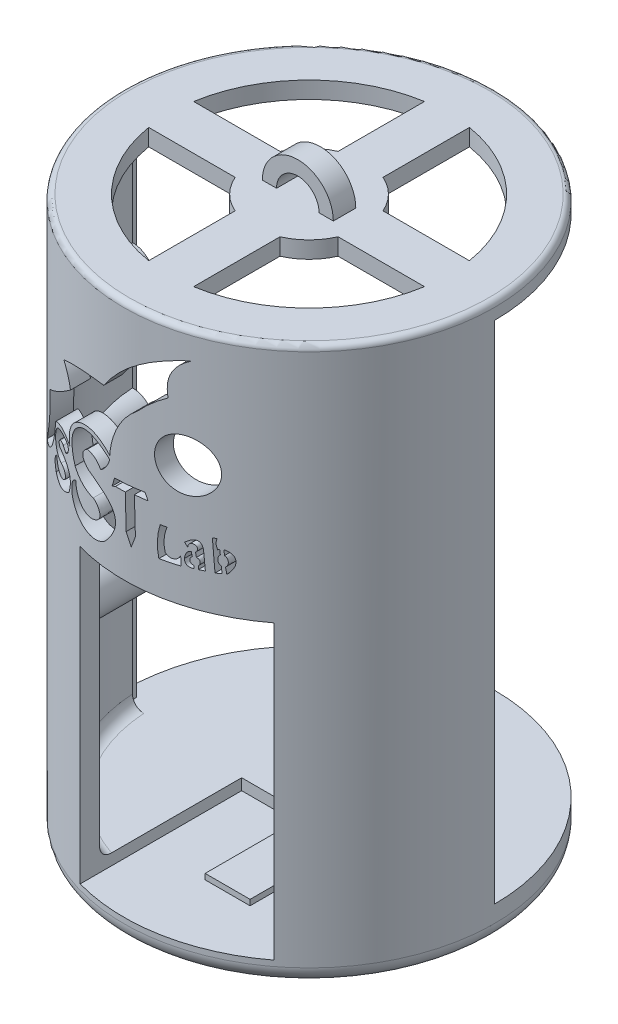
from build123d import *

# Parameters (mm, degrees)
SKETCH1_R                = 33
BOSS_EXTRUDE1_DEPTH      = 3
BOSS_EXTRUDE2_START      = 90
BOSS_EXTRUDE2_DEPTH      = 90
FILLET1_R                = 1
FILLET2_R                = 1
CUT_EXTRUDE2_DEPTH       = 10
BOSS_EXTRUDE3_DEPTH      = 2
BOSS_EXTRUDE5_START      = 6
SKETCH9_R                = 33
BOSS_EXTRUDE5_DEPTH      = 6
FILLET5_R                = 2
BOSS_EXTRUDE6_REACH      = 109.313
BOSS_EXTRUDE6_END_RADIUS = 29.691838434
SKETCH23_R               = 1
BOSS_EXTRUDE7_REACH      = 109.313
BOSS_EXTRUDE7_END_RADIUS = 29.691838434
SKETCH27_R               = 1
CUT_EXTRUDE3_DEPTH       = 3
BOSS_EXTRUDE8_REACH      = 109.313
BOSS_EXTRUDE8_END_RADIUS = 29.691838434
SKETCH28_R               = 1
SKETCH29_R               = 4.559697027
CUT_EXTRUDE4_DEPTH       = 122.082616505
SKETCH38_W               = 29
SKETCH38_H               = 52
CUT_EXTRUDE5_DEPTH       = 30
SKETCH44_W               = 8
SKETCH44_H               = 17
BOSS_EXTRUDE10_DEPTH     = 1
FILLET3_R                = 3


with BuildPart() as part:
    # Sketch1 → Boss-Extrude1 (new body)
    with BuildSketch(Plane(origin=(0, 0, 0), x_dir=(1, 0, 0), z_dir=(0, 1, 0))):
        Circle(SKETCH1_R)
    extrude(amount=BOSS_EXTRUDE1_DEPTH)

    # Sketch2 → Boss-Extrude2 (add)
    with BuildSketch(Plane.XZ.offset(BOSS_EXTRUDE2_START)):
        with BuildLine():
            Line((-33, 0), (-30.737227765, 0))
            Line((-30.737227765, 0), (-30.737227765, 1.8))
            Line((-30.737227765, 1.8), (-29.637227765, 1.8))
            ThreePointArc((-29.637227765, 1.8), (0, 29.691838434), (29.637227765, 1.8))
            Line((29.637227765, 1.8), (30.737227765, 1.8))
            Line((30.737227765, 1.8), (30.737227765, 0))
            Line((30.737227765, 0), (33, 0))
            ThreePointArc((33, 0), (0, 33), (-33, 0))
        make_face()
    extrude(amount=-BOSS_EXTRUDE2_DEPTH)

    # Fillet1
    fillet1_edges = [part.edges().sort_by_distance(p)[0] for p in [
        (0, 0, 29.691838434),
    ]]
    fillet(fillet1_edges, radius=FILLET1_R)

    # Fillet2
    fillet2_edges = [part.edges().sort_by_distance(p)[0] for p in [
        (-33, 3, 0),
    ]]
    fillet(fillet2_edges, radius=FILLET2_R)

    # Sketch5 → Cut-Extrude2 (cut)
    with BuildSketch(Plane(origin=(0, 3, 0), x_dir=(1, 0, 0), z_dir=(0, 1, 0))):
        with BuildLine():
            ThreePointArc((4, 9.16515139), (7.071067812, 7.071067812), (9.16515139, 4))
            Line((9.16515139, 4), (24.550793491, 4))
            ThreePointArc((24.550793491, 4), (17.588937732, 17.588937732), (4, 24.550793491))
            Line((4, 24.550793491), (4, 9.16515139))
        make_face()
        with BuildLine():
            Line((24.550793491, -4), (9.16515139, -4))
            ThreePointArc((9.16515139, -4), (7.071067812, -7.071067812), (4, -9.16515139))
            Line((4, -9.16515139), (4, -24.550793491))
            ThreePointArc((4, -24.550793491), (17.588937732, -17.588937732), (24.550793491, -4))
        make_face()
        with BuildLine():
            ThreePointArc((-9.16515139, 4), (-7.071067812, 7.071067812), (-4, 9.16515139))
            Line((-4, 9.16515139), (-4, 24.550793491))
            ThreePointArc((-4, 24.550793491), (-17.588937732, 17.588937732), (-24.550793491, 4))
            Line((-24.550793491, 4), (-9.16515139, 4))
        make_face()
        with BuildLine():
            Line((-4, -24.550793491), (-4, -9.16515139))
            ThreePointArc((-4, -9.16515139), (-7.071067812, -7.071067812), (-9.16515139, -4))
            Line((-9.16515139, -4), (-24.550793491, -4))
            ThreePointArc((-24.550793491, -4), (-17.588937732, -17.588937732), (-4, -24.550793491))
        make_face()
    extrude(amount=-CUT_EXTRUDE2_DEPTH, mode=Mode.SUBTRACT)

    # Sketch8 → Boss-Extrude3 (add, symmetric)
    with BuildSketch(Plane.XY):
        with BuildLine():
            Line((3.786752201, 3), (6.320875359, 3))
            ThreePointArc((6.320875359, 3), (0, 9.320875359), (-6.320875359, 3))
            Line((-6.320875359, 3), (-3.786752201, 3))
            ThreePointArc((-3.786752201, 3), (0, 6.786752201), (3.786752201, 3))
        make_face()
    extrude(amount=BOSS_EXTRUDE3_DEPTH, both=True)

    # Sketch9 → Boss-Extrude5 (add)
    with BuildSketch(Plane.XZ.offset(90).offset(BOSS_EXTRUDE5_START)):
        Circle(SKETCH9_R)
    extrude(amount=-BOSS_EXTRUDE5_DEPTH)

    # Fillet5
    fillet5_edges = [part.edges().sort_by_distance(p)[0] for p in [
        (0, -90, 29.691838434),
    ]]
    fillet(fillet5_edges, radius=FILLET5_R)

    # Boss-Extrude6: up to this cylinder (the profile starts inside it)
    boss_extrude6_end = Plane(origin=(0, -33.6, 0), z_dir=(0, 1, 0)) * Cylinder(BOSS_EXTRUDE6_END_RADIUS, 301.409676867, mode=Mode.PRIVATE)
    # Sketch23 → Boss-Extrude6 (add, up to the surface)
    with BuildSketch(Plane.XY.offset(1.8), mode=Mode.PRIVATE) as boss_extrude6_sk1:
        with BuildLine():
            Line((29.637227765, -26.4), (29.637227765, -18.4))
            ThreePointArc((29.637227765, -18.4), (25.637227765, -22.4), (29.637227765, -26.4))
        make_face()
        with Locations((28.137227765, -22.4)):
            Circle(SKETCH23_R, mode=Mode.SUBTRACT)
    boss_extrude6_tool1 = extrude(boss_extrude6_sk1.sketch, amount=BOSS_EXTRUDE6_REACH, mode=Mode.PRIVATE) & boss_extrude6_end
    add(boss_extrude6_tool1.solids().sort_by_distance((29.547785, -22.4, 1.8))[0])
    # Sketch23 → Boss-Extrude6 (add, up to the surface)
    with BuildSketch(Plane.XY.offset(1.8), mode=Mode.PRIVATE) as boss_extrude6_sk2:
        with BuildLine():
            Line((29.637227765, -48.8), (29.637227765, -40.8))
            ThreePointArc((29.637227765, -40.8), (25.637227765, -44.8), (29.637227765, -48.8))
        make_face()
        with Locations((28.137227765, -44.8)):
            Circle(SKETCH23_R, mode=Mode.SUBTRACT)
    boss_extrude6_tool2 = extrude(boss_extrude6_sk2.sketch, amount=BOSS_EXTRUDE6_REACH, mode=Mode.PRIVATE) & boss_extrude6_end
    add(boss_extrude6_tool2.solids().sort_by_distance((29.547785, -44.8, 1.8))[0])

    # Boss-Extrude7: up to this cylinder (the profile starts inside it)
    boss_extrude7_end = Plane(origin=(0, -67.2, 0), z_dir=(0, 1, 0)) * Cylinder(BOSS_EXTRUDE7_END_RADIUS, 279.009676867, mode=Mode.PRIVATE)
    # Sketch25 → Boss-Extrude7 (add, up to the surface)
    with BuildSketch(Plane.XY.offset(1.8), mode=Mode.PRIVATE) as boss_extrude7_sk1:
        with BuildLine():
            Line((29.637227765, -62.8), (29.637227765, -71.6))
            ThreePointArc((29.637227765, -71.6), (25.237227765, -67.2), (29.637227765, -62.8))
        make_face()
    boss_extrude7_tool1 = extrude(boss_extrude7_sk1.sketch, amount=BOSS_EXTRUDE7_REACH, mode=Mode.PRIVATE) & boss_extrude7_end
    boss_extrude7 = boss_extrude7_tool1.solids().sort_by_distance((27.76981, -67.2, 1.8))[0]
    add(boss_extrude7)

    # Sketch27 → Cut-Extrude3 (cut)
    with BuildSketch(Plane(origin=(0, 0, 1.8), x_dir=(-1, 0, 0), z_dir=(0, 0, -1))):
        with Locations((-28.137227765, -67.2)):
            Circle(SKETCH27_R)
    cut_extrude3 = extrude(amount=-CUT_EXTRUDE3_DEPTH, mode=Mode.SUBTRACT)

    # Mirror8: Boss-Extrude7, Cut-Extrude3 across plane
    add(boss_extrude7.mirror(Plane(origin=(0, 0, 0), x_dir=(0, 0, 1), z_dir=(1, 0, 0))))
    add(cut_extrude3.mirror(Plane(origin=(0, 0, 0), x_dir=(0, 0, 1), z_dir=(1, 0, 0))), mode=Mode.SUBTRACT)

    # Boss-Extrude8: up to this cylinder (the profile starts inside it)
    boss_extrude8_end = Plane(origin=(0, -33.6, 0), z_dir=(0, 1, 0)) * Cylinder(BOSS_EXTRUDE8_END_RADIUS, 301.409676867, mode=Mode.PRIVATE)
    # Sketch28 → Boss-Extrude8 (add, up to the surface)
    with BuildSketch(Plane.XY.offset(1.8), mode=Mode.PRIVATE) as boss_extrude8_sk1:
        with BuildLine():
            Line((-29.637227765, -18.4), (-29.637227765, -26.4))
            ThreePointArc((-29.637227765, -26.4), (-25.637227765, -22.4), (-29.637227765, -18.4))
        make_face()
        with Locations((-28.137227765, -22.4)):
            Circle(SKETCH28_R, mode=Mode.SUBTRACT)
    boss_extrude8_tool1 = extrude(boss_extrude8_sk1.sketch, amount=BOSS_EXTRUDE8_REACH, mode=Mode.PRIVATE) & boss_extrude8_end
    add(boss_extrude8_tool1.solids().sort_by_distance((-29.547785, -22.4, 1.8))[0])
    # Sketch28 → Boss-Extrude8 (add, up to the surface)
    with BuildSketch(Plane.XY.offset(1.8), mode=Mode.PRIVATE) as boss_extrude8_sk2:
        with BuildLine():
            Line((-29.637227765, -40.8), (-29.637227765, -48.8))
            ThreePointArc((-29.637227765, -48.8), (-25.637227765, -44.8), (-29.637227765, -40.8))
        make_face()
        with Locations((-28.137227765, -44.8)):
            Circle(SKETCH28_R, mode=Mode.SUBTRACT)
    boss_extrude8_tool2 = extrude(boss_extrude8_sk2.sketch, amount=BOSS_EXTRUDE8_REACH, mode=Mode.PRIVATE) & boss_extrude8_end
    add(boss_extrude8_tool2.solids().sort_by_distance((-29.547785, -44.8, 1.8))[0])

    # Sketch29 → Cut-Extrude4 (cut, through all)
    with BuildSketch(Plane.XY.offset(33)):
        with Locations((9.656530357, -18.228015537)):
            Circle(SKETCH29_R)
        with BuildLine():
            Line((10.349709969, -31.260245046), (10.504361263, -32.023388105))
            ThreePointArc((10.504361263, -32.023388105), (10.171122291, -32.739064733), (10.726291598, -33.300338542))
            Line((10.726291598, -33.300338542), (10.726291598, -33.795731563))
            add(Edge.make_bspline(
                [(9.431302826, -32.657530694), (9.451626251, -33.478075731), (9.883289175, -33.857476021), (10.726291598, -33.795731563)],
                knots=[0, 0, 0, 0, 1, 1, 1, 1], degree=3))
            add(Edge.make_bspline(
                [(10.349709969, -31.260245046), (9.809186887, -31.369782299), (9.503051172, -31.835544181), (9.431302826, -32.657530694)],
                knots=[0.205595998, 0.205595998, 0.205595998, 0.205595998, 1, 1, 1, 1], degree=3))
        make_face()
        with BuildLine():
            Line((14.932280644, -33.437499716), (14.834440134, -33.451584224))
            Line((14.834440134, -33.451584224), (14.680633295, -32.383137957))
            add(Edge.make_bspline(
                [(14.680633295, -32.383137957), (16.063570974, -31.487524824), (14.555266559, -30.660195086)],
                knots=[0.323761722, 0.323761722, 0.323761722, 2.695207356, 2.695207356, 2.695207356], degree=2, weights=[1, 0.375627264, 1]))
            Line((14.555266559, -30.660195086), (14.499086471, -29.789527862))
            add(Edge.make_bspline(
                [(14.499086471, -29.789527862), (14.659655884, -29.797531434), (14.818635772, -29.837424421), (14.976026134, -29.909206822)],
                knots=[0.606506576, 0.606506576, 0.606506576, 0.606506576, 1, 1, 1, 1], degree=3))
            add(Edge.make_bspline(
                [(14.976026134, -29.909206822), (15.750605713, -30.28881355), (16.152277789, -31.654433994), (15.521176413, -32.722111185), (14.932280644, -33.437499716)],
                knots=[0, 0, 0, 0, 0.41403424, 1, 1, 1, 1], degree=3))
        make_face()
        with BuildLine():
            Line((13.079083104, -28.318630783), (13.661006417, -28.282376473))
            add(Edge.make_bspline(
                [(13.661006417, -28.282376473), (13.392897645, -29.113489523), (13.745282173, -29.979800603)],
                knots=[0, 0, 0, 1, 1, 1], degree=2))
            add(Edge.make_bspline(
                [(13.745282173, -29.979800603), (13.863069413, -29.915520876), (13.979782744, -29.872786142)],
                knots=[0, 0, 0, 0.186735441, 0.186735441, 0.186735441], degree=2))
            Line((13.979782744, -29.872786142), (14.061785189, -30.683993333))
            add(Edge.make_bspline(
                [(14.061785189, -30.683993333), (12.822472302, -31.565482282), (14.186132292, -32.383137957)],
                knots=[3.498707863, 3.498707863, 3.498707863, 5.804676601, 5.804676601, 5.804676601], degree=2, weights=[1, 0.405761602, 1]))
            Line((14.186132292, -32.383137957), (14.260406146, -33.534218565))
            Line((14.260406146, -33.534218565), (13.411630782, -33.656402955))
            Line((13.411630782, -33.656402955), (13.079083104, -28.318630783))
        make_face()
        with BuildLine():
            Line((9.914405122, -30.801450228), (9.459847308, -30.141421766))
            add(Edge.make_bspline(
                [(11.960627046, -30.421369973), (11.522478353, -28.335382418), (9.459847308, -30.141421766)],
                knots=[0, 0, 0, 1, 1, 1], degree=2))
            Line((11.960627046, -30.421369973), (12.199871952, -33.687801363))
            Line((12.199871952, -33.687801363), (11.29947712, -33.753749443))
            Line((11.29947712, -33.753749443), (11.29947712, -33.147540955))
            ThreePointArc((11.29947712, -33.147540955), (11.528241272, -32.477489187), (11.047448674, -31.957738394))
            Line((11.047448674, -31.957738394), (10.920132511, -31.187545545))
            ThreePointArc((10.920132511, -31.187545545), (10.780185216, -30.04914852), (9.914405122, -30.801450228))
        make_face()
        with BuildLine():
            Line((8.96002864, -34.001870268), (8.915516776, -32.284023801))
            ThreePointArc((8.915516776, -32.284023801), (7.95962245, -33.261727802), (6.700623055, -32.728286521))
            ThreePointArc((6.700623055, -32.728286521), (6.540870623, -30.713624083), (6.978269336, -28.740538189))
            Line((6.978269336, -28.740538189), (5.960408142, -28.766912432))
            add(Edge.make_bspline(
                [(5.960408142, -28.766912432), (5.210895352, -31.405610594), (5.752847306, -34.084972934)],
                knots=[0, 0, 0, 1, 1, 1], degree=2))
            Line((5.752847306, -34.084972934), (8.96002864, -34.001870268))
        make_face()
        Polygon((-2.143920416, -26.642442146), (-1.667472279, -25.144110216), (3.60488507, -24.786275802), (4.076027804, -25.89399446), (3.716786373, -25.903302921), (1.851494331, -25.951635312), (2.018143784, -32.383137957), (1.316583138, -34.259140308), (0.436621898, -32.327877546), (0.280540391, -26.304223682), (-1.503057774, -26.350439268), align=None)
        with BuildLine():
            ThreePointArc((-13.586299428, -14.281448587), (-12.33755407, -15.774519055), (-11.582487273, -17.56853648))
            add(Edge.make_bspline(
                [(-11.582487273, -17.56853648), (-15.390965566, -20.669753066), (-19.414274255, -23.489402314)],
                knots=[0, 0, 0, 1, 1, 1], degree=2))
            ThreePointArc((-19.414274255, -23.489402314), (-19.916409226, -28.718707248), (-22.092051155, -33.500375556))
            add(Edge.make_bspline(
                [(-16.551231359, -26.04682086), (-17.00303121, -29.231789387), (-18.245275033, -32.985297221), (-22.092051155, -33.500375556)],
                knots=[0, 0, 0, 0, 1, 1, 1, 1], degree=3))
            add(Edge.make_bspline(
                [(-11.764626696, -26.304448527), (-12.255785225, -25.999839532), (-13.683739605, -24.922384108), (-15.66739563, -25.404617843), (-16.551231359, -26.04682086)],
                knots=[0, 0, 0, 0, 0.341851998, 1, 1, 1, 1], degree=3))
            add(Edge.make_bspline(
                [(-2.586835971, -22.139304546), (-3.490517884, -21.312299747), (-7.47361686, -18.837169103), (-12.773254661, -22.555675509), (-11.764626696, -26.304448527)],
                knots=[0, 0, 0, 0, 0.283429006, 1, 1, 1, 1], degree=3))
            add(Edge.make_bspline(
                [(-2.502896586, -21.352208476), (-2.552267286, -21.745021338), (-2.586835971, -22.139304546)],
                knots=[0, 0, 0, 1, 1, 1], degree=2))
            ThreePointArc((-2.502896586, -21.352208476), (-0.881018399, -16.58891555), (2.411108391, -12.78347871))
            ThreePointArc((2.411108391, -12.78347871), (4.639551872, -10.614895525), (7.133166389, -8.757316452))
            add(Edge.make_bspline(
                [(7.133166389, -8.757316452), (6.311462059, -4.285702239), (10.422997362, -1.862068704)],
                knots=[0, 0, 0, 1, 1, 1], degree=2))
            add(Edge.make_bspline(
                [(10.422997362, -1.862068704), (1.569313848, -4.441512691), (-3.782221847, -11.987087754)],
                knots=[0, 0, 0, 1, 1, 1], degree=2))
            add(Edge.make_bspline(
                [(-3.782221847, -11.987087754), (-8.971879603, -11.93153831), (-13.586299428, -14.281448587)],
                knots=[0, 0, 0, 1, 1, 1], degree=2))
        make_face()
        with BuildLine():
            ThreePointArc((-2.584717591, -22.792713835), (-3.271434996, -24.227433513), (-4.397534399, -25.350777398))
            add(Edge.make_bspline(
                [(-7.283952803, -23.893313212), (-6.11268406, -23.976721252), (-5.357990658, -23.984192712), (-4.397534399, -25.350777398)],
                knots=[0, 0, 0, 0, 1, 1, 1, 1], degree=3))
            add(Edge.make_bspline(
                [(-7.112456331, -26.896983047), (-9.543418918, -25.411290882), (-7.283952803, -23.893313212)],
                knots=[0, 0, 0, 1, 1, 1], degree=2))
            add(Edge.make_bspline(
                [(-3.56303836, -35.902181673), (1.922659092, -30.137207737), (-7.112456331, -26.896983047)],
                knots=[0, 0, 0, 1, 1, 1], degree=2))
            add(Edge.make_bspline(
                [(-10.078489907, -30.48448721), (-10.89818697, -30.714465561), (-11.474895621, -32.281128908), (-10.205910926, -36.376595033), (-5.715734313, -37.63506733), (-3.56303836, -35.902181673)],
                knots=[0, 0, 0, 0, 0.181470326, 0.363647985, 1, 1, 1, 1], degree=3))
            add(Edge.make_bspline(
                [(-5.990052299, -30.625887269), (-5.218845786, -30.819987735), (-3.702684655, -32.817844053), (-7.666473964, -35.039839816), (-10.190501682, -32.551829914), (-10.078489907, -30.48448721)],
                knots=[0, 0, 0, 0, 0.256771337, 0.455360222, 1, 1, 1, 1], degree=3))
            add(Edge.make_bspline(
                [(-10.309841585, -28.399095046), (-8.682889656, -30.365588542), (-5.990052299, -30.625887269)],
                knots=[0, 0, 0, 1, 1, 1], degree=2))
            add(Edge.make_bspline(
                [(-2.584717591, -22.792713835), (-4.049176984, -21.656577666), (-7.588213918, -20.067011835), (-11.822329548, -23.810963956), (-11.019439394, -27.045166448), (-10.309841585, -28.399095046)],
                knots=[0, 0, 0, 0, 0.406130396, 0.663914516, 1, 1, 1, 1], degree=3))
        make_face()
        with BuildLine():
            add(Edge.make_bspline(
                [(-12.292095905, -26.629998712), (-13.217504347, -25.922665671), (-15.687503968, -25.649497131), (-17.006147466, -28.640178069), (-16.292317299, -30.68587172), (-14.434286508, -30.857962684)],
                knots=[0, 0, 0, 0, 0.411956054, 0.546966603, 1, 1, 1, 1], degree=3))
            add(Edge.make_bspline(
                [(-14.434286508, -30.857962684), (-13.666301393, -30.915827056), (-12.659375796, -31.57179539), (-13.268641295, -32.572635033)],
                knots=[0, 0, 0, 0, 1, 1, 1, 1], degree=3))
            add(Edge.make_bspline(
                [(-13.268641295, -32.572635033), (-14.469590717, -33.570505204), (-15.659759671, -32.252121045)],
                knots=[0, 0, 0, 1, 1, 1], degree=2))
            add(Edge.make_bspline(
                [(-15.659759671, -32.252121045), (-15.988156778, -31.60570395), (-16.158173481, -30.902631067)],
                knots=[0, 0, 0, 1, 1, 1], degree=2))
            add(Edge.make_bspline(
                [(-16.158173481, -30.902631067), (-17.403997199, -31.901191416), (-16.353600397, -33.673992899)],
                knots=[0, 0, 0, 1, 1, 1], degree=2))
            add(Edge.make_bspline(
                [(-16.353600397, -33.673992899), (-14.551193654, -35.615402386), (-12.009484267, -33.63699714)],
                knots=[0, 0, 0, 1, 1, 1], degree=2))
            add(Edge.make_bspline(
                [(-12.009484267, -33.63699714), (-10.482426352, -29.907153562), (-14.821078418, -28.776598199)],
                knots=[0, 0, 0, 1, 1, 1], degree=2))
            add(Edge.make_bspline(
                [(-14.821078418, -28.776598199), (-15.290319343, -28.672872358), (-15.321983734, -27.860645117), (-14.585382183, -27.47394998), (-14.148540534, -27.423205506), (-13.778860624, -27.642070806)],
                knots=[0, 0, 0, 0, 0.517245554, 0.524945652, 1, 1, 1, 1], degree=3))
            Line((-13.778860624, -27.642070806), (-12.941075964, -28.251902961))
            add(Edge.make_bspline(
                [(-12.941075964, -28.251902961), (-11.94855063, -27.78546287), (-12.292095905, -26.629998712)],
                knots=[0, 0, 0, 1, 1, 1], degree=2))
        make_face()
    extrude(amount=-CUT_EXTRUDE4_DEPTH, mode=Mode.SUBTRACT)

    # Sketch38 → Cut-Extrude5 (cut)
    with BuildSketch(Plane.XY.offset(33)):
        with Locations((5.5, -66)):
            Rectangle(SKETCH38_W, SKETCH38_H)
    extrude(amount=-CUT_EXTRUDE5_DEPTH, mode=Mode.SUBTRACT)

    # Sketch44 → Boss-Extrude10 (add)
    with BuildSketch(Plane(origin=(0, -92, 0), x_dir=(1, 0, 0), z_dir=(0, 1, 0))):
        with Locations((5.5, -11.5)):
            Rectangle(SKETCH44_W, SKETCH44_H)
    extrude(amount=BOSS_EXTRUDE10_DEPTH)

    # Fillet3
    fillet3_edges = [part.edges().sort_by_distance(p)[0] for p in [
        (-33, -96, 0),
    ]]
    fillet(fillet3_edges, radius=FILLET3_R)


solid = part.part
